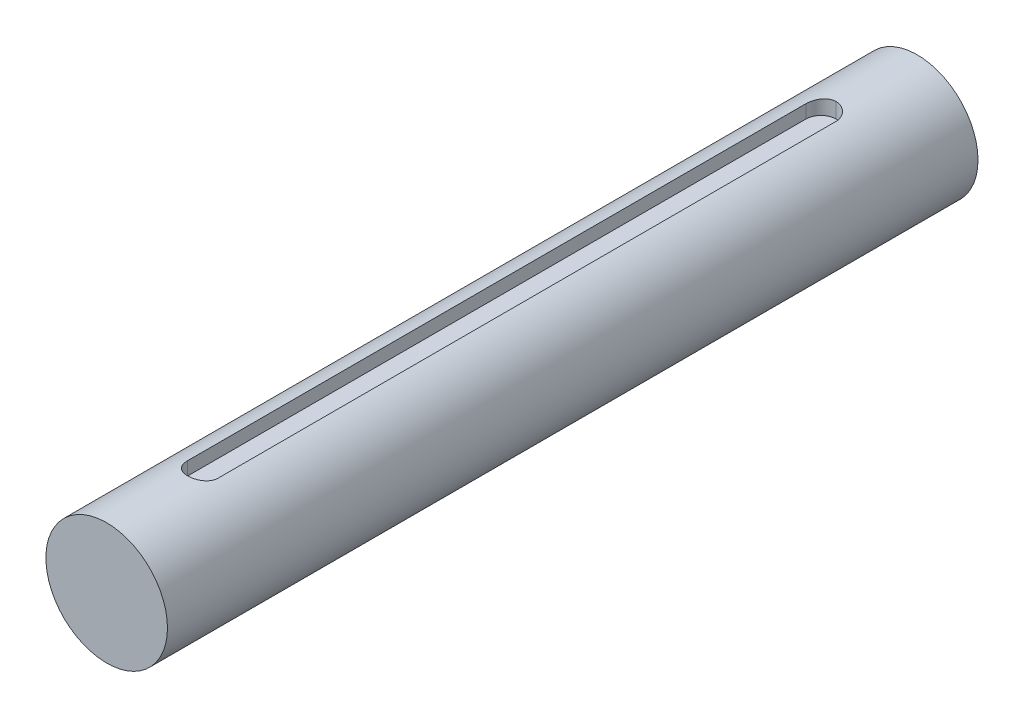
from build123d import *
from build123d.topology import SkipClean

# Parameters (mm, degrees)
SKETCH1_R          = 9.525
EXTRUDE1_DEPTH     = 127
SKETCH2_W          = 4.7625
SKETCH2_H          = 4.7625
CUT_EXTRUDE1_DEPTH = 114.3
EXTRUDE2_START     = -12.7
EXTRUDE2_DEPTH     = 12.7
FILLET1_R          = 2.38125


with BuildPart() as part:
    # Sketch1 → Extrude1 (new body)
    with BuildSketch(Plane.XY):
        Circle(SKETCH1_R)
    extrude(amount=EXTRUDE1_DEPTH)

    # Sketch2 → Cut-Extrude1 (cut)
    with BuildSketch(Plane.XY.offset(127)):
        with Locations((0, 9.525)):
            Rectangle(SKETCH2_W, SKETCH2_H)
    extrude(amount=-CUT_EXTRUDE1_DEPTH, mode=Mode.SUBTRACT)

    # Sketch4 → Extrude2 (add)
    with SkipClean():  # the faces are left unmerged after this step: merging them gives an invalid solid
        with BuildSketch(Plane.XY.offset(127).offset(EXTRUDE2_START)):
            with BuildLine():
                Line((2.38125, 7.14375), (-2.38125, 7.14375))
                Line((-2.38125, 7.14375), (-2.38125, 9.222541593))
                ThreePointArc((-2.38125, 9.222541593), (0, 9.525), (2.38125, 9.222541593))
                Line((2.38125, 9.222541593), (2.38125, 7.14375))
            make_face()
        extrude(amount=EXTRUDE2_DEPTH)

    # Fillet1
    # the kernel refuses this fillet: 2.38125 mm, written as the material it adds along each edge
    with BuildSketch(Plane(origin=(2.38125, 15.175666593, 114.3), x_dir=(0, 0, -1), z_dir=(0, -1, 0))) as fillet1_piece_1_section:
        with BuildLine():
            CenterArc((FILLET1_R, -FILLET1_R), FILLET1_R, 90, 90)
            Line((0, -FILLET1_R), (0, 0))
            Line((0, 0), (FILLET1_R, 0))
        make_face()
    fillet1_piece_1 = extrude(amount=13.985041593, mode=Mode.PRIVATE)
    fillet1_piece_1 = fillet1_piece_1 & Plane(origin=(0, 0, 113.773698621), x_dir=(1, 0, 0), z_dir=(0, 0, -1)) * Cylinder(9.525, 38, mode=Mode.PRIVATE)
    add(fillet1_piece_1)
    with BuildSketch(Plane(origin=(-2.38125, 1.190625, 114.3), x_dir=(0, 0, -1), z_dir=(0, 1, 0))) as fillet1_piece_2_section:
        with BuildLine():
            CenterArc((FILLET1_R, -FILLET1_R), FILLET1_R, 90, 90)
            Line((0, -FILLET1_R), (0, 0))
            Line((0, 0), (FILLET1_R, 0))
        make_face()
    fillet1_piece_2 = extrude(amount=13.985041593, mode=Mode.PRIVATE)
    fillet1_piece_2 = fillet1_piece_2 & Plane(origin=(0, 0, 113.760896634), x_dir=(1, 0, 0), z_dir=(0, 0, -1)) * Cylinder(9.525, 38, mode=Mode.PRIVATE)
    add(fillet1_piece_2)
    with BuildSketch(Plane(origin=(-2.38125, 1.190625, 12.7), x_dir=(0, 0, 1), z_dir=(0, 1, 0))) as fillet1_piece_3_section:
        with BuildLine():
            CenterArc((FILLET1_R, FILLET1_R), FILLET1_R, 180, 90)
            Line((0, FILLET1_R), (0, 0))
            Line((0, 0), (FILLET1_R, 0))
        make_face()
    fillet1_piece_3 = extrude(amount=13.985041593, mode=Mode.PRIVATE)
    fillet1_piece_3 = fillet1_piece_3 & Plane(origin=(0, 0, 13.239103366), x_dir=(1, 0, 0), z_dir=(0, 0, -1)) * Cylinder(9.525, 38, mode=Mode.PRIVATE)
    add(fillet1_piece_3)
    with BuildSketch(Plane(origin=(2.38125, 15.175666593, 12.7), x_dir=(-1, 0, 0), z_dir=(0, -1, 0))) as fillet1_piece_4_section:
        with BuildLine():
            CenterArc((FILLET1_R, -FILLET1_R), FILLET1_R, 90, 90)
            Line((0, -FILLET1_R), (0, 0))
            Line((0, 0), (FILLET1_R, 0))
        make_face()
    fillet1_piece_4 = extrude(amount=13.985041593, mode=Mode.PRIVATE)
    fillet1_piece_4 = fillet1_piece_4 & Plane(origin=(0, 0, 13.226300129), x_dir=(1, 0, 0), z_dir=(0, 0, -1)) * Cylinder(9.525, 38, mode=Mode.PRIVATE)
    add(fillet1_piece_4)


solid = part.part
